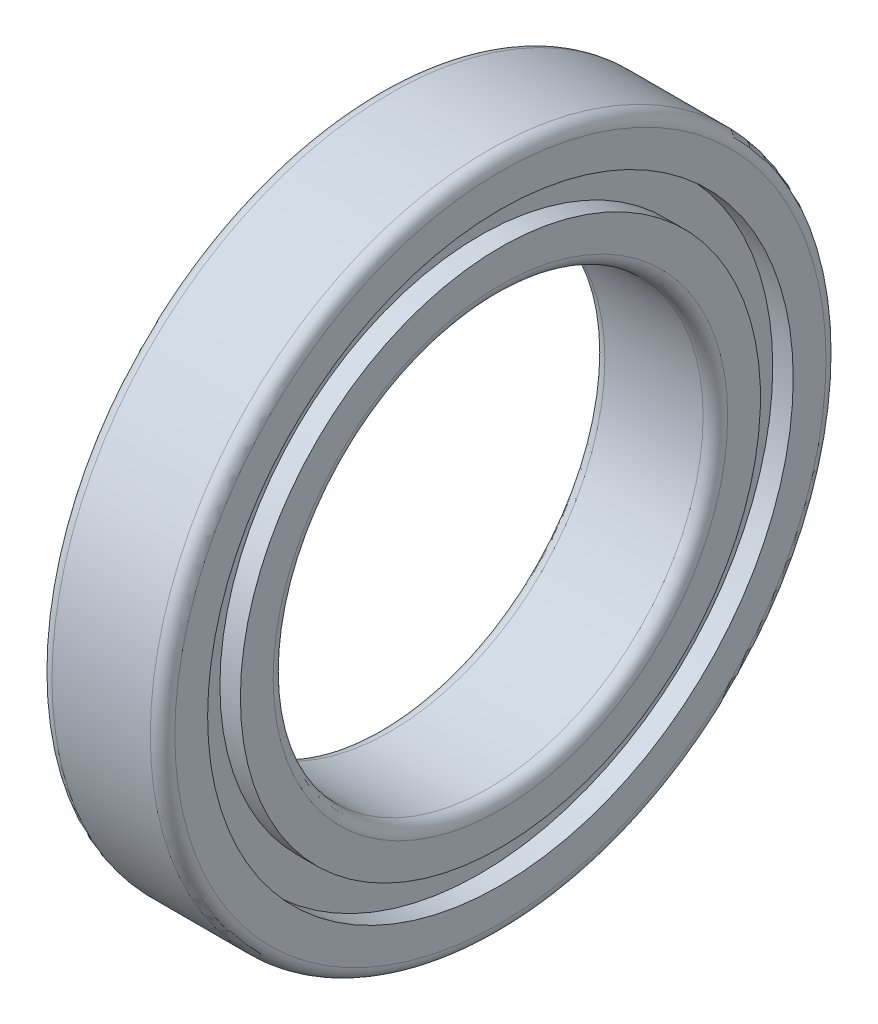
from build123d import *


with BuildPart() as part:
    # Эскиз1 → Повернуть1 (revolve)
    with BuildSketch(Plane.XY):
        with BuildLine():
            Line((4, 17.5), (-4, 17.5))
            ThreePointArc((-4, 17.5), (-4.707106781, 17.792893219), (-5, 18.5))
            Line((-5, 18.5), (-5, 21.166666667))
            Line((-5, 21.166666667), (-3.333333333, 21.166666667))
            Line((-3.333333333, 21.166666667), (-3.333333333, 23.833333333))
            Line((-3.333333333, 23.833333333), (-5, 23.833333333))
            Line((-5, 23.833333333), (-5, 26.5))
            ThreePointArc((-5, 26.5), (-4.707106781, 27.207106781), (-4, 27.5))
            Line((-4, 27.5), (4, 27.5))
            ThreePointArc((4, 27.5), (4.707106781, 27.207106781), (5, 26.5))
            Line((5, 26.5), (5, 23.833333333))
            Line((5, 23.833333333), (3.333333333, 23.833333333))
            Line((3.333333333, 23.833333333), (3.333333333, 21.166666667))
            Line((3.333333333, 21.166666667), (5, 21.166666667))
            Line((5, 21.166666667), (5, 18.5))
            ThreePointArc((5, 18.5), (4.707106781, 17.792893219), (4, 17.5))
        make_face()
    revolve(axis=Axis((-1000, 0, 0), (1, 0, 0)))


solid = part.part
